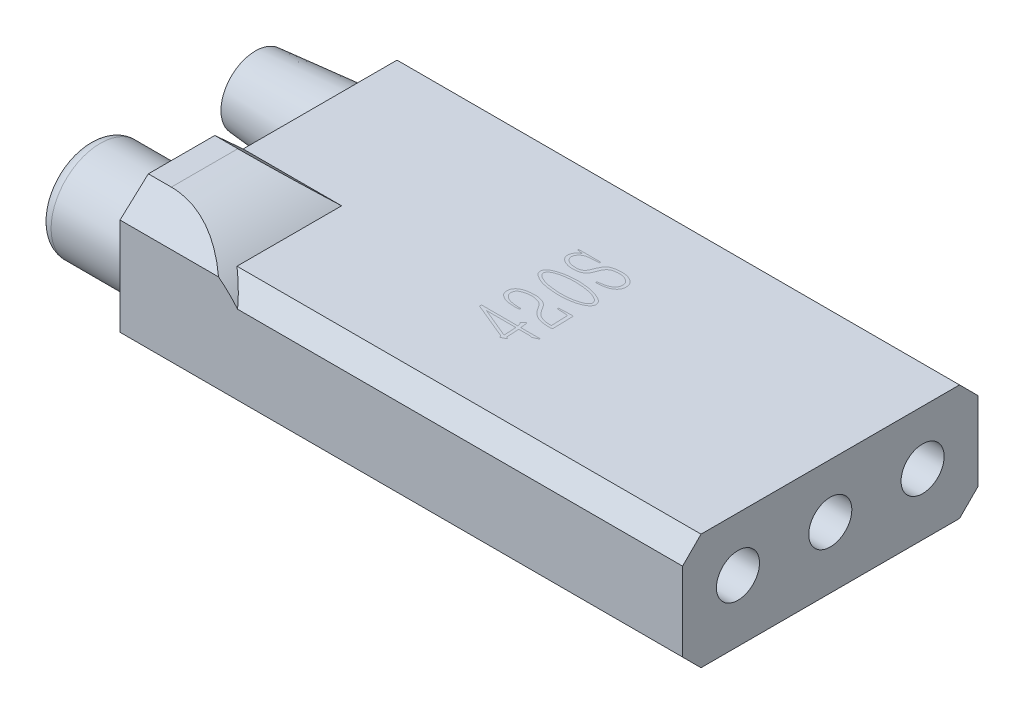
from build123d import *

# Parameters (mm, degrees)
SKETCH_1_W          = 45.7
SKETCH_1_H          = 24
EXTRUDE_1_DEPTH     = 9.4
SKETCH_2_R          = 1.75
CUT_EXTRUDE_1_DEPTH = 6
SKETCH_3_R          = 4
EXTRUDE_2_DEPTH     = 7.6
EXTRUDE_3_DEPTH     = 8
FILLET_1_R          = 10
CHAMFER_1_SIZE      = 1.5
SKETCH_5_R          = 3.5
EXTRUDE_4_DEPTH     = 8
EXTRUDE_4_TAPER     = 5
FILLET_2_R          = 1


with BuildPart() as part:
    # 草图1 → 凸台-拉伸1 (new body)
    with BuildSketch(Plane(origin=(0, 0, 0), x_dir=(1, 0, 0), z_dir=(0, 1, 0))):
        Rectangle(SKETCH_1_W, SKETCH_1_H)
    extrude(amount=EXTRUDE_1_DEPTH)

    # 草图2 → 切除-拉伸1 (cut)
    with BuildSketch(Plane(origin=(22.85, 0, 0), x_dir=(0, 0, -1), z_dir=(1, 0, 0))):
        with Locations((-7.5, 5)):
            Circle(SKETCH_2_R)
        with Locations((0, 5)):
            Circle(SKETCH_2_R)
        with Locations((7.5, 5)):
            Circle(SKETCH_2_R)
    extrude(amount=-CUT_EXTRUDE_1_DEPTH, mode=Mode.SUBTRACT)

    # 草图3 → 凸台-拉伸2 (add)
    with BuildSketch(Plane.ZY.offset(22.85)):
        with Locations(Location((7, 5, 0), (0, 0, 180))):
            Circle(SKETCH_3_R)
    extrude(amount=EXTRUDE_2_DEPTH)

    # 草图4 → 凸台-拉伸3 (add)
    with BuildSketch(Plane.ZY.offset(22.85)):
        Polygon((4.3, 11.5), (9.7, 11.5), (12, 9.4), (2, 9.4), align=None)
    extrude(amount=-EXTRUDE_3_DEPTH)

    # 圆角1
    # the kernel refuses this fillet: 10 mm, written as the material it takes off along each edge
    with BuildSketch(Plane(origin=(-14.85, 11.5, -11.027671056), x_dir=(-1, 0, 0), z_dir=(0, 0, 1))) as fillet_1_piece_1:
        with BuildLine():
            CenterArc((6.131068422, 10), FILLET_1_R, 232.185511494, 37.814488506)
            Line((0, 2.1), (0, 0))
            Line((0, 0), (6.131068422, 0))
        make_face()
    extrude(amount=36.055342112, mode=Mode.SUBTRACT)

    # 倒角1
    # the kernel refuses this chamfer: 1.5 mm, written as the material it takes off along each edge
    with BuildSketch(Plane(origin=(-18.707524482, 9.4, 12), x_dir=(0, -1, 0), z_dir=(1, 0, 0))) as chamfer_1_piece_1_section:
        Polygon((CHAMFER_1_SIZE, 0), (0, CHAMFER_1_SIZE), (0, 0), align=None)
    chamfer_1_piece_1 = extrude(amount=45.415048964, mode=Mode.PRIVATE)
    chamfer_1_piece_1 = chamfer_1_piece_1 - Plane(origin=(-20.981068422, 1.5, 12), x_dir=(-1, 0, 0), z_dir=(0, 0, -1)) * Cylinder(10, 97, mode=Mode.PRIVATE)
    add(chamfer_1_piece_1, mode=Mode.SUBTRACT)
    with BuildSketch(Plane(origin=(-26.707524482, 0, 12), x_dir=(0, 1, 0), z_dir=(1, 0, 0)), Plane(origin=(26.707524482, 9.4, -12), x_dir=(0, 0, 1), z_dir=(-1, 0, 0))) as chamfer_1_piece_2:
        Polygon((CHAMFER_1_SIZE, 0), (0, -CHAMFER_1_SIZE), (0, 0), align=None)
    extrude(amount=53.415048964, mode=Mode.SUBTRACT)
    with BuildSketch(Plane(origin=(26.707524482, 0, -12), x_dir=(0, 0, 1), z_dir=(-1, 0, 0))) as chamfer_1_piece_3:
        Polygon((CHAMFER_1_SIZE, 0), (0, CHAMFER_1_SIZE), (0, 0), align=None)
    extrude(amount=53.415048964, mode=Mode.SUBTRACT)

    # 草图5 → 凸台-拉伸4 (add)
    with BuildSketch(Plane.ZY.offset(22.85)):
        with Locations((-7, 5)):
            Circle(SKETCH_5_R)
    extrude(amount=EXTRUDE_4_DEPTH, taper=EXTRUDE_4_TAPER)

    # 圆角2
    fillet_2_edges = [part.edges().sort_by_distance(p)[0] for p in [
        (-30.45, 5, 11),
    ]]
    fillet(fillet_2_edges, radius=FILLET_2_R)


solid = part.part
